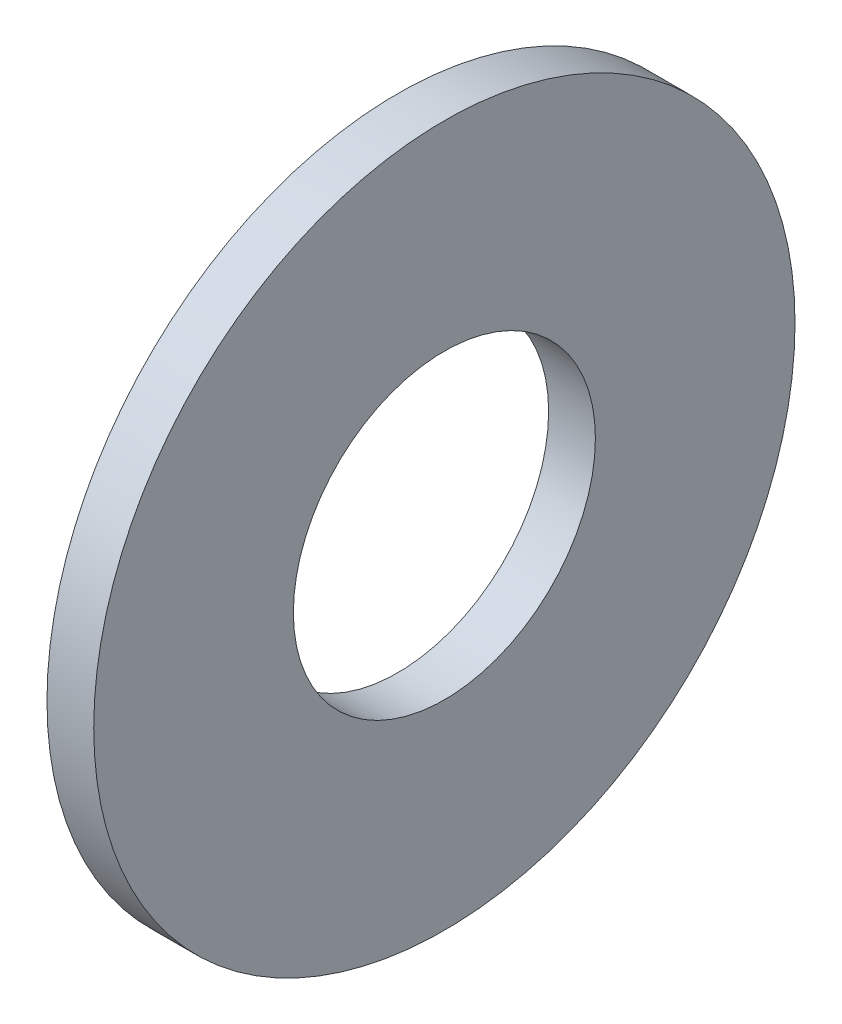
from build123d import *

# Parameters (mm, degrees)
SKETCH1_R           = 9.525
SKETCH1_R_2         = 4.1021
BOSS_EXTRUDE1_DEPTH = 1.27


with BuildPart() as part:
    # Sketch1 → Boss-Extrude1 (new body)
    with BuildSketch(Plane(origin=(0, 0, 0), x_dir=(0, 0, -1), z_dir=(1, 0, 0))):
        Circle(SKETCH1_R)
        Circle(SKETCH1_R_2, mode=Mode.SUBTRACT)
    extrude(amount=BOSS_EXTRUDE1_DEPTH)


solid = part.part
